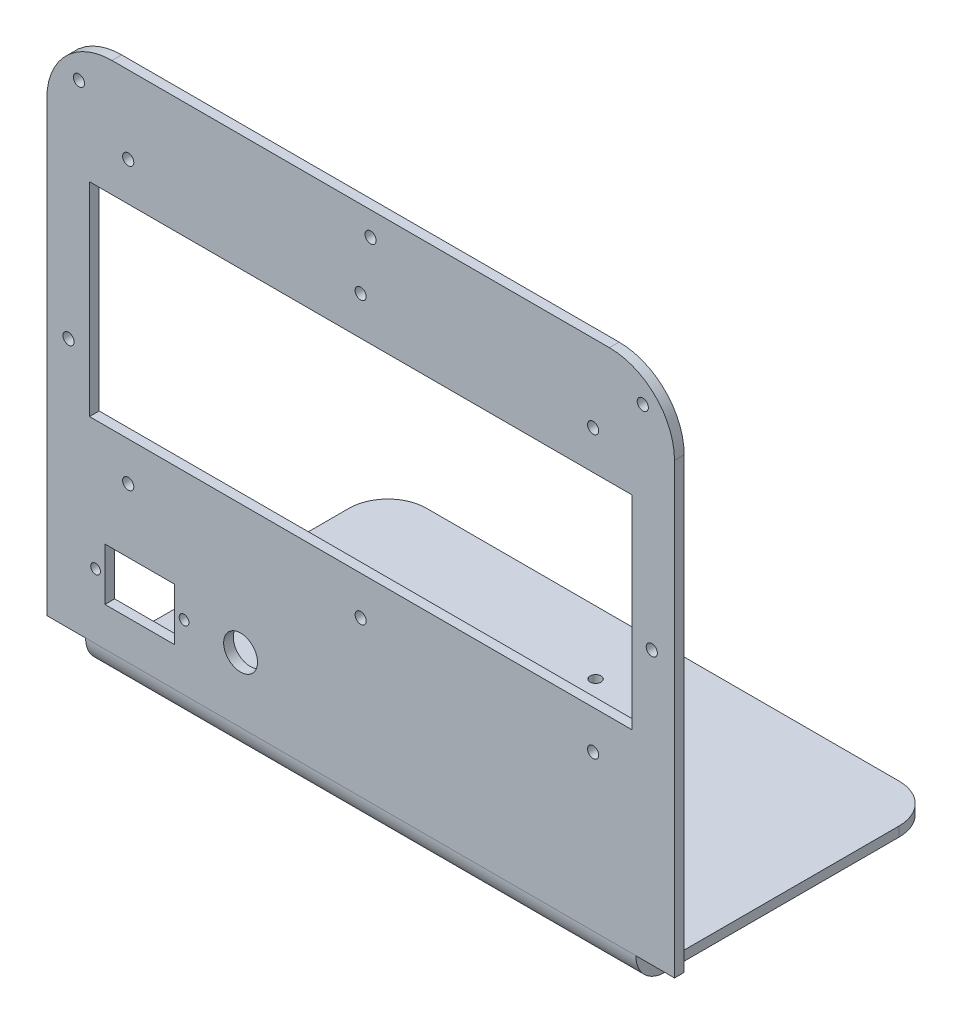
from build123d import *

# Parameters (mm, degrees)
BASE_FLANGE1_DEPTH              = 102.87
SKETCH6_W                       = 9.525
SKETCH6_H                       = 99.06
CUT_EXTRUDE1_DEPTH              = 12.7
FILLET1_R                       = 21.336
FILLET2_R                       = 12.7
SKETCH8_W                       = 177.8
SKETCH8_H                       = 66.675
CUT_EXTRUDE2_DEPTH              = 10.16
F_27_0_144_DIAMETER_HOLE1_D     = 3.6576
F_27_0_144_DIAMETER_HOLE2_D     = 3.6576
CUT_EXTRUDE3_REACH              = 210.856
SKETCH17_R                      = 1.6
SKETCH17_W                      = 22.86
SKETCH17_H                      = 17.15
CUT_EXTRUDE4_REACH              = 210.856
SKETCH18_R                      = 5.5499
F_9_64_0_14063_DIAMETER_HOLE1_D = 3.572002


# Sheet-metal steps are written as plain solids
with BuildPart() as part:
    # Sketch1 → Base-Flange1 (new, symmetric)
    with BuildSketch(Plane.YZ):
        with BuildLine():
            Line((-25.4, -73.66), (-25.4, 15.875))
            ThreePointArc((-25.4, 15.875), (-22.610192091, 22.610192091), (-15.875, 25.4))
            Line((-15.875, 25.4), (152.4, 25.4))
            Line((152.4, 25.4), (152.4, 22.225))
            Line((152.4, 22.225), (-15.875, 22.225))
            ThreePointArc((-15.875, 22.225), (-20.365128061, 20.365128061), (-22.225, 15.875))
            Line((-22.225, 15.875), (-22.225, -73.66))
            Line((-22.225, -73.66), (-25.4, -73.66))
        make_face()
    extrude(amount=BASE_FLANGE1_DEPTH, both=True)

    # Sketch6 → Cut-Extrude1 (cut)
    with BuildSketch(Plane.YZ.offset(102.87)):
        with Locations((-20.6375, -24.13)):
            Rectangle(SKETCH6_W, SKETCH6_H)
    cut_extrude1 = extrude(amount=-CUT_EXTRUDE1_DEPTH, mode=Mode.SUBTRACT)

    # Mirror1: Cut-Extrude1 across plane
    add(cut_extrude1.mirror(Plane(origin=(0, 0, 0), x_dir=(0, 0, 1), z_dir=(1, 0, 0))), mode=Mode.SUBTRACT)

    # Fillet1
    fillet1_edges = [part.edges().sort_by_distance(p)[0] for p in [
        (102.87, 152.4, 23.8125),
        (-102.87, 152.4, 23.8125),
    ]]
    fillet(fillet1_edges, radius=FILLET1_R)

    # Fillet2
    fillet2_edges = [part.edges().sort_by_distance(p)[0] for p in [
        (90.17, -23.8125, -73.66),
        (-90.17, -23.8125, -73.66),
    ]]
    fillet(fillet2_edges, radius=FILLET2_R)

    # Sketch8 → Cut-Extrude2 (cut)
    with BuildSketch(Plane.XY.offset(25.4)):
        with Locations((0, 80.9625)):
            Rectangle(SKETCH8_W, SKETCH8_H)
    extrude(amount=-CUT_EXTRUDE2_DEPTH, mode=Mode.SUBTRACT)

    # #27 (0.144) Diameter Hole1 (through all)
    with Locations(Plane.XY.offset(25.4)):
        with Locations((-76.2, 127), (0, 127), (76.2, 127), (76.2, 34.925), (0, 34.925), (-76.2, 34.925)):
            Hole(F_27_0_144_DIAMETER_HOLE1_D / 2)

    # #27 (0.144) Diameter Hole2 (through all)
    with Locations(Plane.XY.offset(25.4)):
        with Locations((92.4814, 141.7574), (95.4278, 73.533), (95.4278, -25.273), (-95.758, -18.034), (-95.758, 66.294), (-92.3544, 141.351), (3.2512, 144.5768)):
            Hole(F_27_0_144_DIAMETER_HOLE2_D / 2)

    # Sketch17 → Cut-Extrude3 (cut, up to next)
    with BuildSketch(Plane.XY.offset(25.4), mode=Mode.PRIVATE) as cut_extrude3_sk1:
        with Locations((-86.89, 5.4)):
            Circle(SKETCH17_R)
    cut_extrude3_tool1 = extrude(cut_extrude3_sk1.sketch, amount=-CUT_EXTRUDE3_REACH, mode=Mode.PRIVATE) & part.part
    # Sketch17 → Cut-Extrude3 (cut, up to next)
    with BuildSketch(Plane.XY.offset(25.4), mode=Mode.PRIVATE) as cut_extrude3_sk2:
        with Locations((-57.89, 5.4)):
            Circle(SKETCH17_R)
    cut_extrude3_tool2 = extrude(cut_extrude3_sk2.sketch, amount=-CUT_EXTRUDE3_REACH, mode=Mode.PRIVATE) & part.part
    # Sketch17 → Cut-Extrude3 (cut, up to next)
    with BuildSketch(Plane.XY.offset(25.4), mode=Mode.PRIVATE) as cut_extrude3_sk3:
        with Locations((-72.39, 5.4)):
            Rectangle(SKETCH17_W, SKETCH17_H)
    cut_extrude3_tool3 = extrude(cut_extrude3_sk3.sketch, amount=-CUT_EXTRUDE3_REACH, mode=Mode.PRIVATE) & part.part
    add(cut_extrude3_tool1.solids().sort_by_distance((-86.89, 5.4, 25.4))[0], mode=Mode.SUBTRACT)
    add(cut_extrude3_tool2.solids().sort_by_distance((-57.89, 5.4, 25.4))[0], mode=Mode.SUBTRACT)
    add(cut_extrude3_tool3.solids().sort_by_distance((-72.39, 5.4, 25.4))[0], mode=Mode.SUBTRACT)

    # Sketch18 → Cut-Extrude4 (cut, up to next)
    with BuildSketch(Plane.XY.offset(25.4), mode=Mode.PRIVATE) as cut_extrude4_sk1:
        with Locations((-39.37, 5.4)):
            Circle(SKETCH18_R)
    cut_extrude4_tool1 = extrude(cut_extrude4_sk1.sketch, amount=-CUT_EXTRUDE4_REACH, mode=Mode.PRIVATE) & part.part
    add(cut_extrude4_tool1.solids().sort_by_distance((-39.37, 5.4, 25.4))[0], mode=Mode.SUBTRACT)

    # 9/64 (0.14063) Diameter Hole1 (through all)
    with Locations(Plane(origin=(0, -22.225, 0), x_dir=(1, 0, 0), z_dir=(0, 1, 0))):
        with Locations((-1.292500082, 52.897499996), (69.407499996, 4.887500004)):
            Hole(F_9_64_0_14063_DIAMETER_HOLE1_D / 2)


solid = part.part
